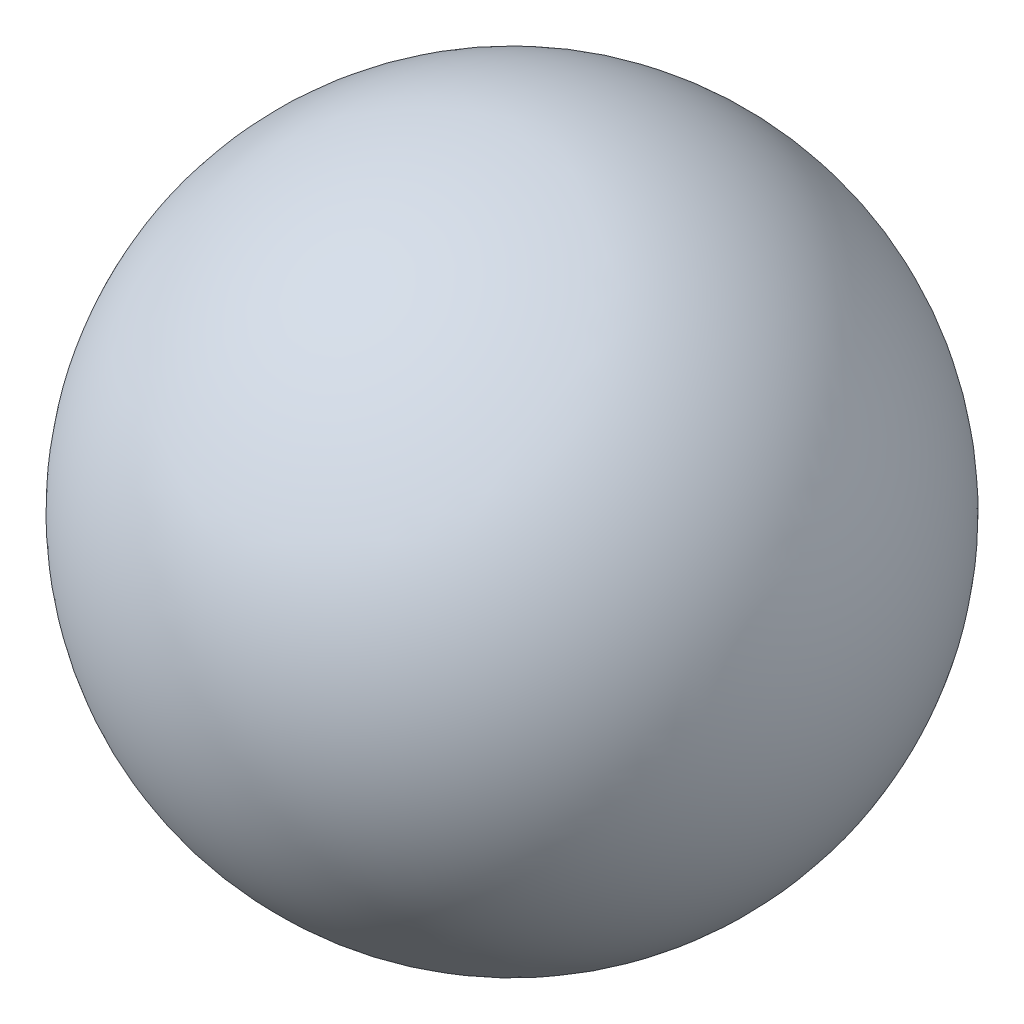
from build123d import *


with BuildPart() as part:
    # Sketch1 → Revolve1 (revolve)
    with BuildSketch(Plane(origin=(0, 0, 0), x_dir=(1, 0, 0), z_dir=(0, 1, 0))):
        with BuildLine():
            ThreePointArc((1.607, 0), (0, 1.607), (-1.607, 0))
            Line((-1.607, 0), (1.607, 0))
        make_face()
    revolve(axis=Axis((-1.607, 0, 0), (1, 0, 0)))


solid = part.part
